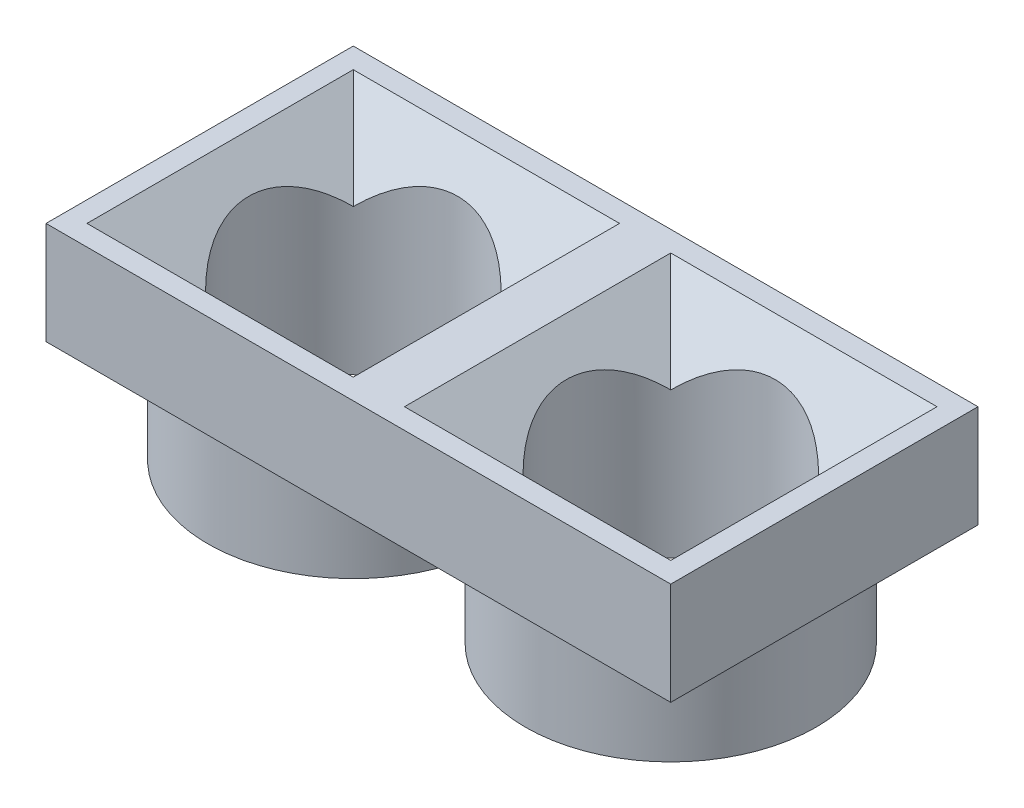
from build123d import *
from build123d.topology import SkipClean

# Parameters (mm, degrees)
SKETCH1_W               = 30.5
SKETCH1_H               = 15
BOSS_EXTRUDE1_DEPTH     = 5
SKETCH2_W               = 13
SKETCH2_H               = 13
CUT_EXTRUDE1_DEPTH      = 3
CHAMFER1_SIZE           = 3
CUT_EXTRUDE3_DEPTH      = 18.257244855
CUT_EXTRUDE3_DEPTH_BACK = 18.257244855
SKETCH4_R               = 5.1
SKETCH5_R               = 7.1
SKETCH5_R_2             = 5.1
BOSS_EXTRUDE3_DEPTH     = 5


with BuildPart() as part:
    # Sketch1 → Boss-Extrude1 (new body)
    with BuildSketch(Plane(origin=(0, 0, 0), x_dir=(1, 0, 0), z_dir=(0, 1, 0))):
        Rectangle(SKETCH1_W, SKETCH1_H)
    extrude(amount=BOSS_EXTRUDE1_DEPTH)

    # Sketch2 → Cut-Extrude1 (cut)
    with BuildSketch(Plane(origin=(0, 5, 0), x_dir=(1, 0, 0), z_dir=(0, 1, 0))):
        with Locations((-7.75, 0)):
            Rectangle(SKETCH2_W, SKETCH2_H)
        with Locations((7.75, 0)):
            Rectangle(SKETCH2_W, SKETCH2_H)
    extrude(amount=-CUT_EXTRUDE1_DEPTH, mode=Mode.SUBTRACT)

    # Chamfer1
    chamfer1_edges = [part.edges().sort_by_distance(p)[0] for p in [
        (-7.75, 2, -6.5),
        (-1.25, 2, 0),
        (-7.75, 2, 6.5),
        (-14.25, 2, 0),
        (7.75, 2, -6.5),
        (14.25, 2, 0),
        (7.75, 2, 6.5),
        (1.25, 2, 0),
    ]]
    chamfer(chamfer1_edges, length=CHAMFER1_SIZE - 0.0001)  # a hair under: the kernel refuses the full size

    # Sketch4 → Cut-Extrude3 (cut, two sides: drawn at the far end of the back side and taken through both)
    with BuildSketch(Plane(origin=(0, 2, 0), x_dir=(1, 0, 0), z_dir=(0, 1, 0)).offset(-CUT_EXTRUDE3_DEPTH_BACK)):
        with Locations(Location((-7.75, 0, 0), (0, 0, 270))):
            Circle(SKETCH4_R)
        with Locations(Location((7.75, 0, 0), (0, 0, 270))):
            Circle(SKETCH4_R)
    extrude(amount=CUT_EXTRUDE3_DEPTH + CUT_EXTRUDE3_DEPTH_BACK, mode=Mode.SUBTRACT)

    # Sketch5 → Boss-Extrude3 (add)
    # profile 1 of 2: a face of its own
    with SkipClean():  # the faces are left unmerged after this step: merging them gives an invalid solid
        with BuildSketch(Plane.XZ):
            with Locations(Location((-7.75, 0, 0), (0, 0, 270))):
                Circle(SKETCH5_R)
            with Locations(Location((-7.75, 0, 0), (0, 0, 45))):
                Circle(SKETCH5_R_2, mode=Mode.SUBTRACT)
        # profile 2 of 2: a face of its own
        with BuildSketch(Plane.XZ):
            with Locations(Location((7.75, 0, 0), (0, 0, 90))):
                Circle(SKETCH5_R)
            with Locations(Location((7.75, 0, 0), (0, 0, 135))):
                Circle(SKETCH5_R_2, mode=Mode.SUBTRACT)
        extrude(amount=BOSS_EXTRUDE3_DEPTH)


solid = part.part
